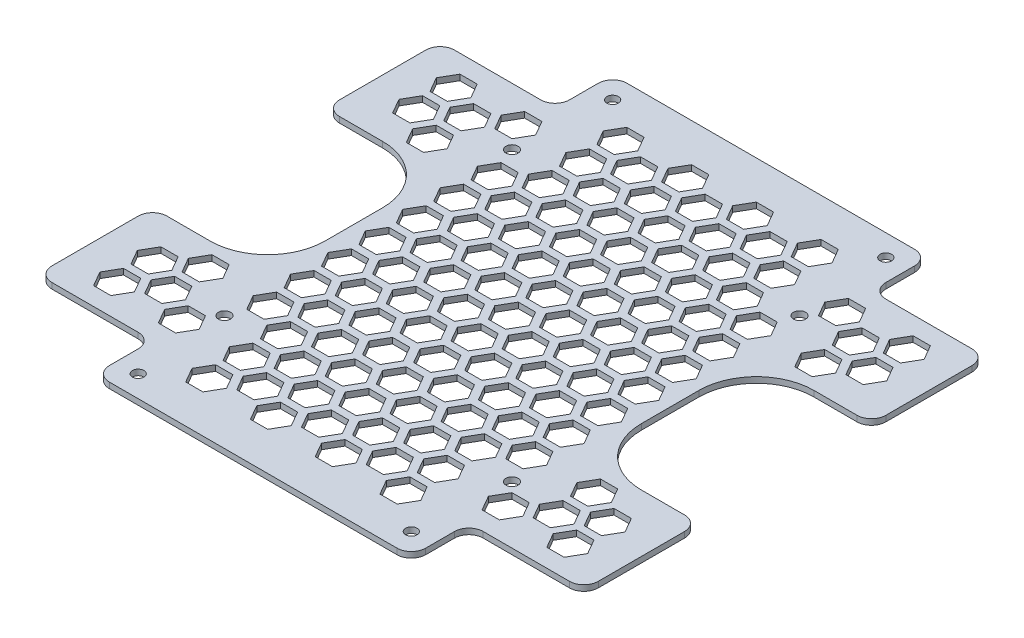
from build123d import *

# Parameters (mm, degrees)
SKETCH_1_W          = 40
SKETCH_1_H          = 40
SKETCH_1_W_2        = 110
SKETCH_1_H_2        = 180
EXTRUDE_1_DEPTH     = 2
SKETCH_5_R          = 2
CUT_EXTRUDE_2_DEPTH = 131.877805605
OTHER_2_DEPTH       = 2
FILLET_1_R          = 5
FILLET_2_R          = 20
SKETCH_8_R          = 2.1
CUT_EXTRUDE_3_DEPTH = 131.877805605


with BuildPart() as part:
    # 草图1 → 凸台-拉伸1 (new body)
    with BuildSketch(Plane(origin=(0, 0, 0), x_dir=(1, 0, 0), z_dir=(0, 1, 0))):
        with Locations((-75, 50)):
            Rectangle(SKETCH_1_W, SKETCH_1_H)
        Rectangle(SKETCH_1_W_2, SKETCH_1_H_2)
        with Locations((75, -50)):
            Rectangle(SKETCH_1_W, SKETCH_1_H)
        with Locations((75, 50)):
            Rectangle(SKETCH_1_W, SKETCH_1_H)
        with Locations((-75, -50)):
            Rectangle(SKETCH_1_W, SKETCH_1_H)
    extrude(amount=EXTRUDE_1_DEPTH)

    # 草图5 → 切除-拉伸2 (cut, through all)
    with BuildSketch(Plane(origin=(0, 2, 0), x_dir=(1, 0, 0), z_dir=(0, 1, 0))):
        with Locations(Location((-47.5, 82.5, 0), (0, 0, 270))):
            Circle(SKETCH_5_R)
        with Locations(Location((47.5, 82.5, 0), (0, 0, 90))):
            Circle(SKETCH_5_R)
        with Locations(Location((-47.5, -82.5, 0), (0, 0, 90))):
            Circle(SKETCH_5_R)
        with Locations(Location((47.5, -82.5, 0), (0, 0, 270))):
            Circle(SKETCH_5_R)
    extrude(amount=-CUT_EXTRUDE_2_DEPTH, mode=Mode.SUBTRACT)

    # 填充阵列2: read off the stored shape, not the designer's step
    # 填充阵列2 outline → 填充阵列2 (cut)
    with BuildSketch(Plane(origin=(0, 0, 0), x_dir=(1, 0, 0), z_dir=(0, 1, 0))):
        Polygon((84.808311744, -58.5), (81.808311744, -53.303847577), (75.808311744, -53.303847577), (72.808311744, -58.5), (75.808311744, -63.696152423), (81.808311744, -63.696152423), align=None)
        Polygon((28.516660498, 39), (25.516660498, 44.196152423), (19.516660498, 44.196152423), (16.516660498, 39), (19.516660498, 33.803847577), (25.516660498, 33.803847577), align=None)
        Polygon((73.549981495, -39), (70.549981495, -33.803847577), (64.549981495, -33.803847577), (61.549981495, -39), (64.549981495, -44.196152423), (70.549981495, -44.196152423), align=None)
        Polygon((17.258330249, 58.5), (14.258330249, 63.696152423), (8.258330249, 63.696152423), (5.258330249, 58.5), (8.258330249, 53.303847577), (14.258330249, 53.303847577), align=None)
        Polygon((51.033320997, 0), (48.033320997, 5.196152423), (42.033320997, 5.196152423), (39.033320997, 0), (42.033320997, -5.196152423), (48.033320997, -5.196152423), align=None)
        Polygon((39.774990748, 19.5), (36.774990748, 24.696152423), (30.774990748, 24.696152423), (27.774990748, 19.5), (30.774990748, 14.303847577), (36.774990748, 14.303847577), align=None)
        Polygon((59.291651246, -53.303847577), (53.291651246, -53.303847577), (50.291651246, -58.5), (53.291651246, -63.696152423), (59.291651246, -63.696152423), (62.291651246, -58.5), align=None)
        Polygon((36.774990748, -53.303847577), (30.774990748, -53.303847577), (27.774990748, -58.5), (30.774990748, -63.696152423), (36.774990748, -63.696152423), (39.774990748, -58.5), align=None)
        Polygon((14.258330249, -53.303847577), (8.258330249, -53.303847577), (5.258330249, -58.5), (8.258330249, -63.696152423), (14.258330249, -63.696152423), (17.258330249, -58.5), align=None)
        Polygon((-75.808311744, -53.303847577), (-81.808311744, -53.303847577), (-84.808311744, -58.5), (-81.808311744, -63.696152423), (-75.808311744, -63.696152423), (-72.808311744, -58.5), align=None)
        Polygon((-53.291651246, -53.303847577), (-59.291651246, -53.303847577), (-62.291651246, -58.5), (-59.291651246, -63.696152423), (-53.291651246, -63.696152423), (-50.291651246, -58.5), align=None)
        Polygon((-30.774990748, -53.303847577), (-36.774990748, -53.303847577), (-39.774990748, -58.5), (-36.774990748, -63.696152423), (-30.774990748, -63.696152423), (-27.774990748, -58.5), align=None)
        Polygon((-8.258330249, -53.303847577), (-14.258330249, -53.303847577), (-17.258330249, -58.5), (-14.258330249, -63.696152423), (-8.258330249, -63.696152423), (-5.258330249, -58.5), align=None)
        Polygon((3, 44.196152423), (-3, 44.196152423), (-6, 39), (-3, 33.803847577), (3, 33.803847577), (6, 39), align=None)
        Polygon((48.033320997, 44.196152423), (42.033320997, 44.196152423), (39.033320997, 39), (42.033320997, 33.803847577), (48.033320997, 33.803847577), (51.033320997, 39), align=None)
        Polygon((70.549981495, 44.196152423), (64.549981495, 44.196152423), (61.549981495, 39), (64.549981495, 33.803847577), (70.549981495, 33.803847577), (73.549981495, 39), align=None)
        Polygon((-42.033320997, 44.196152423), (-48.033320997, 44.196152423), (-51.033320997, 39), (-48.033320997, 33.803847577), (-42.033320997, 33.803847577), (-39.033320997, 39), align=None)
        Polygon((-64.549981495, 44.196152423), (-70.549981495, 44.196152423), (-73.549981495, 39), (-70.549981495, 33.803847577), (-64.549981495, 33.803847577), (-61.549981495, 39), align=None)
        Polygon((-19.516660498, 44.196152423), (-25.516660498, 44.196152423), (-28.516660498, 39), (-25.516660498, 33.803847577), (-19.516660498, 33.803847577), (-16.516660498, 39), align=None)
        Polygon((-3, 5.196152423), (-6, 0), (-3, -5.196152423), (3, -5.196152423), (6, 0), (3, 5.196152423), align=None)
        Polygon((-14.258330249, -14.303847577), (-17.258330249, -19.5), (-14.258330249, -24.696152423), (-8.258330249, -24.696152423), (-5.258330249, -19.5), (-8.258330249, -14.303847577), align=None)
        Polygon((8.258330249, 24.696152423), (5.258330249, 19.5), (8.258330249, 14.303847577), (14.258330249, 14.303847577), (17.258330249, 19.5), (14.258330249, 24.696152423), align=None)
        Polygon((30.774990748, 63.696152423), (27.774990748, 58.5), (30.774990748, 53.303847577), (36.774990748, 53.303847577), (39.774990748, 58.5), (36.774990748, 63.696152423), align=None)
        Polygon((-25.516660498, -33.803847577), (-28.516660498, -39), (-25.516660498, -44.196152423), (-19.516660498, -44.196152423), (-16.516660498, -39), (-19.516660498, -33.803847577), align=None)
        Polygon((28.516660498, 26), (25.516660498, 31.196152423), (19.516660498, 31.196152423), (16.516660498, 26), (19.516660498, 20.803847577), (25.516660498, 20.803847577), align=None)
        Polygon((51.033320997, -13), (48.033320997, -7.803847577), (42.033320997, -7.803847577), (39.033320997, -13), (42.033320997, -18.196152423), (48.033320997, -18.196152423), align=None)
        Polygon((6, 65), (3, 70.196152423), (-3, 70.196152423), (-6, 65), (-3, 59.803847577), (3, 59.803847577), align=None)
        Polygon((17.258330249, 45.5), (14.258330249, 50.696152423), (8.258330249, 50.696152423), (5.258330249, 45.5), (8.258330249, 40.303847577), (14.258330249, 40.303847577), align=None)
        Polygon((39.774990748, 6.5), (36.774990748, 11.696152423), (30.774990748, 11.696152423), (27.774990748, 6.5), (30.774990748, 1.303847577), (36.774990748, 1.303847577), align=None)
        Polygon((73.549981495, -52), (70.549981495, -46.803847577), (64.549981495, -46.803847577), (61.549981495, -52), (64.549981495, -57.196152423), (70.549981495, -57.196152423), align=None)
        Polygon((48.033320997, 31.196152423), (42.033320997, 31.196152423), (39.033320997, 26), (42.033320997, 20.803847577), (48.033320997, 20.803847577), (51.033320997, 26), align=None)
        Polygon((-42.033320997, 31.196152423), (-48.033320997, 31.196152423), (-51.033320997, 26), (-48.033320997, 20.803847577), (-42.033320997, 20.803847577), (-39.033320997, 26), align=None)
        Polygon((3, 31.196152423), (-3, 31.196152423), (-6, 26), (-3, 20.803847577), (3, 20.803847577), (6, 26), align=None)
        Polygon((-19.516660498, 31.196152423), (-25.516660498, 31.196152423), (-28.516660498, 26), (-25.516660498, 20.803847577), (-19.516660498, 20.803847577), (-16.516660498, 26), align=None)
        Polygon((8.258330249, 11.696152423), (5.258330249, 6.5), (8.258330249, 1.303847577), (14.258330249, 1.303847577), (17.258330249, 6.5), (14.258330249, 11.696152423), align=None)
        Polygon((-3, -7.803847577), (-6, -13), (-3, -18.196152423), (3, -18.196152423), (6, -13), (3, -7.803847577), align=None)
        Polygon((30.774990748, 50.696152423), (27.774990748, 45.5), (30.774990748, 40.303847577), (36.774990748, 40.303847577), (39.774990748, 45.5), (36.774990748, 50.696152423), align=None)
        Polygon((-25.516660498, -46.803847577), (-28.516660498, -52), (-25.516660498, -57.196152423), (-19.516660498, -57.196152423), (-16.516660498, -52), (-19.516660498, -46.803847577), align=None)
        Polygon((-36.774990748, -66.303847577), (-39.774990748, -71.5), (-36.774990748, -76.696152423), (-30.774990748, -76.696152423), (-27.774990748, -71.5), (-30.774990748, -66.303847577), align=None)
        Polygon((-14.258330249, -27.303847577), (-17.258330249, -32.5), (-14.258330249, -37.696152423), (-8.258330249, -37.696152423), (-5.258330249, -32.5), (-8.258330249, -27.303847577), align=None)
        Polygon((17.258330249, -19.5), (14.258330249, -14.303847577), (8.258330249, -14.303847577), (5.258330249, -19.5), (8.258330249, -24.696152423), (14.258330249, -24.696152423), align=None)
        Polygon((28.516660498, -39), (25.516660498, -33.803847577), (19.516660498, -33.803847577), (16.516660498, -39), (19.516660498, -44.196152423), (25.516660498, -44.196152423), align=None)
        Polygon((-5.258330249, 19.5), (-8.258330249, 24.696152423), (-14.258330249, 24.696152423), (-17.258330249, 19.5), (-14.258330249, 14.303847577), (-8.258330249, 14.303847577), align=None)
        Polygon((-27.774990748, 58.5), (-30.774990748, 63.696152423), (-36.774990748, 63.696152423), (-39.774990748, 58.5), (-36.774990748, 53.303847577), (-30.774990748, 53.303847577), align=None)
        Polygon((25.516660498, 5.196152423), (19.516660498, 5.196152423), (16.516660498, 0), (19.516660498, -5.196152423), (25.516660498, -5.196152423), (28.516660498, 0), align=None)
        Polygon((-42.033320997, 5.196152423), (-48.033320997, 5.196152423), (-51.033320997, 0), (-48.033320997, -5.196152423), (-42.033320997, -5.196152423), (-39.033320997, 0), align=None)
        Polygon((-19.516660498, 5.196152423), (-25.516660498, 5.196152423), (-28.516660498, 0), (-25.516660498, -5.196152423), (-19.516660498, -5.196152423), (-16.516660498, 0), align=None)
        Polygon((-27.774990748, 19.5), (-30.774990748, 24.696152423), (-36.774990748, 24.696152423), (-39.774990748, 19.5), (-36.774990748, 14.303847577), (-30.774990748, 14.303847577), align=None)
        Polygon((6, -39), (3, -33.803847577), (-3, -33.803847577), (-6, -39), (-3, -44.196152423), (3, -44.196152423), align=None)
        Polygon((-50.291651246, 58.5), (-53.291651246, 63.696152423), (-59.291651246, 63.696152423), (-62.291651246, 58.5), (-59.291651246, 53.303847577), (-53.291651246, 53.303847577), align=None)
        Polygon((36.774990748, -14.303847577), (30.774990748, -14.303847577), (27.774990748, -19.5), (30.774990748, -24.696152423), (36.774990748, -24.696152423), (39.774990748, -19.5), align=None)
        Polygon((-30.774990748, -14.303847577), (-36.774990748, -14.303847577), (-39.774990748, -19.5), (-36.774990748, -24.696152423), (-30.774990748, -24.696152423), (-27.774990748, -19.5), align=None)
        Polygon((-5.258330249, 71.5), (-8.258330249, 76.696152423), (-14.258330249, 76.696152423), (-17.258330249, 71.5), (-14.258330249, 66.303847577), (-8.258330249, 66.303847577), align=None)
        Polygon((51.033320997, -26), (48.033320997, -20.803847577), (42.033320997, -20.803847577), (39.033320997, -26), (42.033320997, -31.196152423), (48.033320997, -31.196152423), align=None)
        Polygon((6, 52), (3, 57.196152423), (-3, 57.196152423), (-6, 52), (-3, 46.803847577), (3, 46.803847577), align=None)
        Polygon((17.258330249, 32.5), (14.258330249, 37.696152423), (8.258330249, 37.696152423), (5.258330249, 32.5), (8.258330249, 27.303847577), (14.258330249, 27.303847577), align=None)
        Polygon((28.516660498, 13), (25.516660498, 18.196152423), (19.516660498, 18.196152423), (16.516660498, 13), (19.516660498, 7.803847577), (25.516660498, 7.803847577), align=None)
        Polygon((39.774990748, -6.5), (36.774990748, -1.303847577), (30.774990748, -1.303847577), (27.774990748, -6.5), (30.774990748, -11.696152423), (36.774990748, -11.696152423), align=None)
        Polygon((14.258330249, 76.696152423), (8.258330249, 76.696152423), (5.258330249, 71.5), (8.258330249, 66.303847577), (14.258330249, 66.303847577), (17.258330249, 71.5), align=None)
        Polygon((36.774990748, 76.696152423), (30.774990748, 76.696152423), (27.774990748, 71.5), (30.774990748, 66.303847577), (36.774990748, 66.303847577), (39.774990748, 71.5), align=None)
        Polygon((-30.774990748, 76.696152423), (-36.774990748, 76.696152423), (-39.774990748, 71.5), (-36.774990748, 66.303847577), (-30.774990748, 66.303847577), (-27.774990748, 71.5), align=None)
        Polygon((-36.774990748, 37.696152423), (-39.774990748, 32.5), (-36.774990748, 27.303847577), (-30.774990748, 27.303847577), (-27.774990748, 32.5), (-30.774990748, 37.696152423), align=None)
        Polygon((-48.033320997, 18.196152423), (-51.033320997, 13), (-48.033320997, 7.803847577), (-42.033320997, 7.803847577), (-39.033320997, 13), (-42.033320997, 18.196152423), align=None)
        Polygon((-81.808311744, -40.303847577), (-84.808311744, -45.5), (-81.808311744, -50.696152423), (-75.808311744, -50.696152423), (-72.808311744, -45.5), (-75.808311744, -40.303847577), align=None)
        Polygon((-25.516660498, 57.196152423), (-28.516660498, 52), (-25.516660498, 46.803847577), (-19.516660498, 46.803847577), (-16.516660498, 52), (-19.516660498, 57.196152423), align=None)
        Polygon((39.774990748, -32.5), (36.774990748, -27.303847577), (30.774990748, -27.303847577), (27.774990748, -32.5), (30.774990748, -37.696152423), (36.774990748, -37.696152423), align=None)
        Polygon((28.516660498, -13), (25.516660498, -7.803847577), (19.516660498, -7.803847577), (16.516660498, -13), (19.516660498, -18.196152423), (25.516660498, -18.196152423), align=None)
        Polygon((-16.516660498, 65), (-19.516660498, 70.196152423), (-25.516660498, 70.196152423), (-28.516660498, 65), (-25.516660498, 59.803847577), (-19.516660498, 59.803847577), align=None)
        Polygon((-5.258330249, 45.5), (-8.258330249, 50.696152423), (-14.258330249, 50.696152423), (-17.258330249, 45.5), (-14.258330249, 40.303847577), (-8.258330249, 40.303847577), align=None)
        Polygon((-30.774990748, -27.303847577), (-36.774990748, -27.303847577), (-39.774990748, -32.5), (-36.774990748, -37.696152423), (-30.774990748, -37.696152423), (-27.774990748, -32.5), align=None)
        Polygon((14.258330249, -27.303847577), (8.258330249, -27.303847577), (5.258330249, -32.5), (8.258330249, -37.696152423), (14.258330249, -37.696152423), (17.258330249, -32.5), align=None)
        Polygon((75.808311744, 50.696152423), (72.808311744, 45.5), (75.808311744, 40.303847577), (81.808311744, 40.303847577), (84.808311744, 45.5), (81.808311744, 50.696152423), align=None)
        Polygon((8.258330249, -66.303847577), (5.258330249, -71.5), (8.258330249, -76.696152423), (14.258330249, -76.696152423), (17.258330249, -71.5), (14.258330249, -66.303847577), align=None)
        Polygon((19.516660498, -46.803847577), (16.516660498, -52), (19.516660498, -57.196152423), (25.516660498, -57.196152423), (28.516660498, -52), (25.516660498, -46.803847577), align=None)
        Polygon((51.033320997, -39), (48.033320997, -33.803847577), (42.033320997, -33.803847577), (39.033320997, -39), (42.033320997, -44.196152423), (48.033320997, -44.196152423), align=None)
        Polygon((-5.258330249, 58.5), (-8.258330249, 63.696152423), (-14.258330249, 63.696152423), (-17.258330249, 58.5), (-14.258330249, 53.303847577), (-8.258330249, 53.303847577), align=None)
        Polygon((75.808311744, 63.696152423), (72.808311744, 58.5), (75.808311744, 53.303847577), (81.808311744, 53.303847577), (84.808311744, 58.5), (81.808311744, 63.696152423), align=None)
        Polygon((53.291651246, 63.696152423), (50.291651246, 58.5), (53.291651246, 53.303847577), (59.291651246, 53.303847577), (62.291651246, 58.5), (59.291651246, 63.696152423), align=None)
        Polygon((39.774990748, 32.5), (36.774990748, 37.696152423), (30.774990748, 37.696152423), (27.774990748, 32.5), (30.774990748, 27.303847577), (36.774990748, 27.303847577), align=None)
        Polygon((28.516660498, 52), (25.516660498, 57.196152423), (19.516660498, 57.196152423), (16.516660498, 52), (19.516660498, 46.803847577), (25.516660498, 46.803847577), align=None)
        Polygon((51.033320997, 13), (48.033320997, 18.196152423), (42.033320997, 18.196152423), (39.033320997, 13), (42.033320997, 7.803847577), (48.033320997, 7.803847577), align=None)
        Polygon((84.808311744, -45.5), (81.808311744, -40.303847577), (75.808311744, -40.303847577), (72.808311744, -45.5), (75.808311744, -50.696152423), (81.808311744, -50.696152423), align=None)
        Polygon((-8.258330249, 37.696152423), (-14.258330249, 37.696152423), (-17.258330249, 32.5), (-14.258330249, 27.303847577), (-8.258330249, 27.303847577), (-5.258330249, 32.5), align=None)
        Polygon((-3, -20.803847577), (-6, -26), (-3, -31.196152423), (3, -31.196152423), (6, -26), (3, -20.803847577), align=None)
        Polygon((8.258330249, -1.303847577), (5.258330249, -6.5), (8.258330249, -11.696152423), (14.258330249, -11.696152423), (17.258330249, -6.5), (14.258330249, -1.303847577), align=None)
        Polygon((-25.516660498, -59.803847577), (-28.516660498, -65), (-25.516660498, -70.196152423), (-19.516660498, -70.196152423), (-16.516660498, -65), (-19.516660498, -59.803847577), align=None)
        Polygon((-14.258330249, -40.303847577), (-17.258330249, -45.5), (-14.258330249, -50.696152423), (-8.258330249, -50.696152423), (-5.258330249, -45.5), (-8.258330249, -40.303847577), align=None)
        Polygon((-30.774990748, 11.696152423), (-36.774990748, 11.696152423), (-39.774990748, 6.5), (-36.774990748, 1.303847577), (-30.774990748, 1.303847577), (-27.774990748, 6.5), align=None)
        Polygon((-8.258330249, 11.696152423), (-14.258330249, 11.696152423), (-17.258330249, 6.5), (-14.258330249, 1.303847577), (-8.258330249, 1.303847577), (-5.258330249, 6.5), align=None)
        Polygon((-27.774990748, 45.5), (-30.774990748, 50.696152423), (-36.774990748, 50.696152423), (-39.774990748, 45.5), (-36.774990748, 40.303847577), (-30.774990748, 40.303847577), align=None)
        Polygon((39.774990748, -71.5), (36.774990748, -66.303847577), (30.774990748, -66.303847577), (27.774990748, -71.5), (30.774990748, -76.696152423), (36.774990748, -76.696152423), align=None)
        Polygon((-42.033320997, -7.803847577), (-48.033320997, -7.803847577), (-51.033320997, -13), (-48.033320997, -18.196152423), (-42.033320997, -18.196152423), (-39.033320997, -13), align=None)
        Polygon((-19.516660498, -7.803847577), (-25.516660498, -7.803847577), (-28.516660498, -13), (-25.516660498, -18.196152423), (-19.516660498, -18.196152423), (-16.516660498, -13), align=None)
        Polygon((-14.258330249, -66.303847577), (-17.258330249, -71.5), (-14.258330249, -76.696152423), (-8.258330249, -76.696152423), (-5.258330249, -71.5), (-8.258330249, -66.303847577), align=None)
        Polygon((-3, -46.803847577), (-6, -52), (-3, -57.196152423), (3, -57.196152423), (6, -52), (3, -46.803847577), align=None)
        Polygon((25.516660498, -20.803847577), (19.516660498, -20.803847577), (16.516660498, -26), (19.516660498, -31.196152423), (25.516660498, -31.196152423), (28.516660498, -26), align=None)
        Polygon((-19.516660498, -20.803847577), (-25.516660498, -20.803847577), (-28.516660498, -26), (-25.516660498, -31.196152423), (-19.516660498, -31.196152423), (-16.516660498, -26), align=None)
        Polygon((-42.033320997, -20.803847577), (-48.033320997, -20.803847577), (-51.033320997, -26), (-48.033320997, -31.196152423), (-42.033320997, -31.196152423), (-39.033320997, -26), align=None)
        Polygon((19.516660498, -59.803847577), (16.516660498, -65), (19.516660498, -70.196152423), (25.516660498, -70.196152423), (28.516660498, -65), (25.516660498, -59.803847577), align=None)
        Polygon((30.774990748, -40.303847577), (27.774990748, -45.5), (30.774990748, -50.696152423), (36.774990748, -50.696152423), (39.774990748, -45.5), (36.774990748, -40.303847577), align=None)
        Polygon((28.516660498, 65), (25.516660498, 70.196152423), (19.516660498, 70.196152423), (16.516660498, 65), (19.516660498, 59.803847577), (25.516660498, 59.803847577), align=None)
        Polygon((70.549981495, 57.196152423), (64.549981495, 57.196152423), (61.549981495, 52), (64.549981495, 46.803847577), (70.549981495, 46.803847577), (73.549981495, 52), align=None)
        Polygon((-64.549981495, 57.196152423), (-70.549981495, 57.196152423), (-73.549981495, 52), (-70.549981495, 46.803847577), (-64.549981495, 46.803847577), (-61.549981495, 52), align=None)
        Polygon((-14.258330249, -1.303847577), (-17.258330249, -6.5), (-14.258330249, -11.696152423), (-8.258330249, -11.696152423), (-5.258330249, -6.5), (-8.258330249, -1.303847577), align=None)
        Polygon((-3, 18.196152423), (-6, 13), (-3, 7.803847577), (3, 7.803847577), (6, 13), (3, 18.196152423), align=None)
        Polygon((-36.774990748, -40.303847577), (-39.774990748, -45.5), (-36.774990748, -50.696152423), (-30.774990748, -50.696152423), (-27.774990748, -45.5), (-30.774990748, -40.303847577), align=None)
        Polygon((-48.033320997, -33.803847577), (-51.033320997, -39), (-48.033320997, -44.196152423), (-42.033320997, -44.196152423), (-39.033320997, -39), (-42.033320997, -33.803847577), align=None)
        Polygon((-36.774990748, -1.303847577), (-39.774990748, -6.5), (-36.774990748, -11.696152423), (-30.774990748, -11.696152423), (-27.774990748, -6.5), (-30.774990748, -1.303847577), align=None)
        Polygon((-25.516660498, 18.196152423), (-28.516660498, 13), (-25.516660498, 7.803847577), (-19.516660498, 7.803847577), (-16.516660498, 13), (-19.516660498, 18.196152423), align=None)
        Polygon((-70.549981495, -46.803847577), (-73.549981495, -52), (-70.549981495, -57.196152423), (-64.549981495, -57.196152423), (-61.549981495, -52), (-64.549981495, -46.803847577), align=None)
        Polygon((-64.549981495, -33.803847577), (-70.549981495, -33.803847577), (-73.549981495, -39), (-70.549981495, -44.196152423), (-64.549981495, -44.196152423), (-61.549981495, -39), align=None)
        Polygon((-3, -59.803847577), (-6, -65), (-3, -70.196152423), (3, -70.196152423), (6, -65), (3, -59.803847577), align=None)
        Polygon((8.258330249, -40.303847577), (5.258330249, -45.5), (8.258330249, -50.696152423), (14.258330249, -50.696152423), (17.258330249, -45.5), (14.258330249, -40.303847577), align=None)
        Polygon((-75.808311744, 50.696152423), (-81.808311744, 50.696152423), (-84.808311744, 45.5), (-81.808311744, 40.303847577), (-75.808311744, 40.303847577), (-72.808311744, 45.5), align=None)
        Polygon((-75.808311744, 63.696152423), (-81.808311744, 63.696152423), (-84.808311744, 58.5), (-81.808311744, 53.303847577), (-75.808311744, 53.303847577), (-72.808311744, 58.5), align=None)
    extrude(amount=OTHER_2_DEPTH, mode=Mode.SUBTRACT)

    # 圆角1
    fillet_1_edges = [part.edges().sort_by_distance(p)[0] for p in [
        (-55, 1, -70),
        (-55, 1, -90),
        (55, 1, -90),
        (55, 1, -70),
        (95, 1, -70),
        (95, 1, -30),
        (95, 1, 30),
        (95, 1, 70),
        (55, 1, 70),
        (55, 1, 90),
        (-55, 1, 90),
        (-55, 1, 70),
        (-95, 1, 70),
        (-95, 1, 30),
        (-95, 1, -30),
        (-95, 1, -70),
    ]]
    fillet(fillet_1_edges, radius=FILLET_1_R)

    # 圆角2
    fillet_2_edges = [part.edges().sort_by_distance(p)[0] for p in [
        (55, 1, -30),
        (55, 1, 30),
        (-55, 1, 30),
        (-55, 1, -30),
    ]]
    fillet(fillet_2_edges, radius=FILLET_2_R)

    # 草图8 → 切除-拉伸3 (cut, through all)
    with BuildSketch(Plane(origin=(0, 2, 0), x_dir=(1, 0, 0), z_dir=(0, 1, 0))):
        with Locations(Location((-50, -50, 0), (0, 0, 270))):
            Circle(SKETCH_8_R)
        with Locations(Location((-50, 50, 0), (0, 0, 270))):
            Circle(SKETCH_8_R)
        with Locations(Location((50, 50, 0), (0, 0, 270))):
            Circle(SKETCH_8_R)
        with Locations(Location((50, -50, 0), (0, 0, 270))):
            Circle(SKETCH_8_R)
    extrude(amount=-CUT_EXTRUDE_3_DEPTH, mode=Mode.SUBTRACT)


solid = part.part
